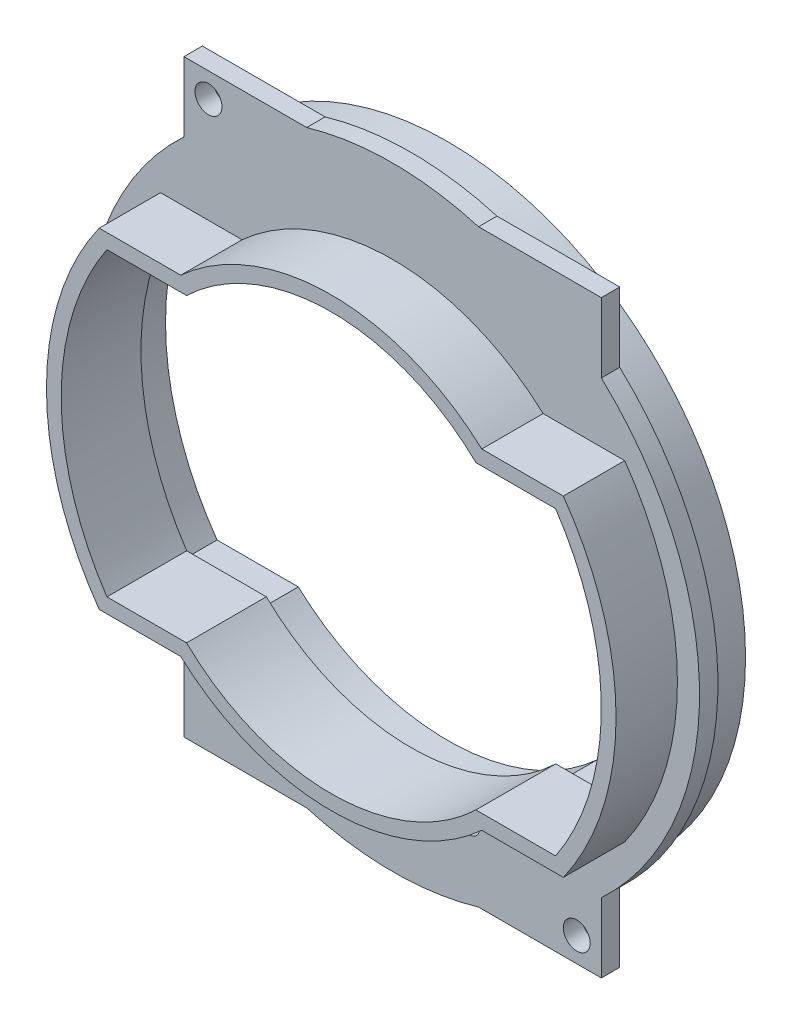
from build123d import *

# Parameters (mm, degrees)
SKETCH_1_R          = 25
EXTRUDE_1_DEPTH     = 1.5
EXTRUDE_2_DEPTH     = 5
SKETCH_5_R          = 24.25
EXTRUDE_4_DEPTH     = 3
EXTRUDE_5_DEPTH     = 1.5
SKETCH_7_R          = 0.5
CUT_EXTRUDE_2_DEPTH = 37.609425016
SKETCH_8_R          = 0.8
CUT_EXTRUDE_3_DEPTH = 4
SKETCH_9_R          = 1.1
CUT_EXTRUDE_4_DEPTH = 10


with BuildPart() as part:
    # 草图1 → 凸台-拉伸1 (new body)
    with BuildSketch(Plane.XY):
        Circle(SKETCH_1_R)
        with BuildLine():
            Line((-18.273956879, 12.25), (-11.787175234, 12.25))
            ThreePointArc((-11.787175234, 12.25), (0, 17), (11.787175234, 12.25))
            Line((11.787175234, 12.25), (18.273956879, 12.25))
            ThreePointArc((18.273956879, 12.25), (22, 0), (18.273956879, -12.25))
            Line((18.273956879, -12.25), (11.787175234, -12.25))
            ThreePointArc((11.787175234, -12.25), (0, -17), (-11.787175234, -12.25))
            Line((-11.787175234, -12.25), (-18.273956879, -12.25))
            ThreePointArc((-18.273956879, -12.25), (-22, 0), (-18.273956879, 12.25))
        make_face(mode=Mode.SUBTRACT)
    extrude(amount=EXTRUDE_1_DEPTH)

    # 草图2 → 凸台-拉伸2 (add)
    with BuildSketch(Plane.XY.offset(1.5)):
        with BuildLine():
            Line((-18.903372715, 13.45), (-12.261219352, 13.45))
            ThreePointArc((-12.261219352, 13.45), (0, 18.2), (12.261219352, 13.45))
            Line((12.261219352, 13.45), (18.903372715, 13.45))
            ThreePointArc((18.903372715, 13.45), (23.2, 0), (18.903372715, -13.45))
            Line((18.903372715, -13.45), (12.261219352, -13.45))
            ThreePointArc((12.261219352, -13.45), (0, -18.2), (-12.261219352, -13.45))
            Line((-12.261219352, -13.45), (-18.903372715, -13.45))
            ThreePointArc((-18.903372715, -13.45), (-23.2, 0), (-18.903372715, 13.45))
        make_face()
        with BuildLine():
            Line((-18.273956879, 12.25), (-11.787175234, 12.25))
            ThreePointArc((-11.787175234, 12.25), (0, 17), (11.787175234, 12.25))
            Line((11.787175234, 12.25), (18.273956879, 12.25))
            ThreePointArc((18.273956879, 12.25), (22, 0), (18.273956879, -12.25))
            Line((18.273956879, -12.25), (11.787175234, -12.25))
            ThreePointArc((11.787175234, -12.25), (0, -17), (-11.787175234, -12.25))
            Line((-11.787175234, -12.25), (-18.273956879, -12.25))
            ThreePointArc((-18.273956879, -12.25), (-22, 0), (-18.273956879, 12.25))
        make_face(mode=Mode.SUBTRACT)
    extrude(amount=EXTRUDE_2_DEPTH)

    # 草图5 → 凸台-拉伸4 (add)
    with BuildSketch(Plane(origin=(0, 0, 0), x_dir=(-1, 0, 0), z_dir=(0, 0, -1))):
        Circle(SKETCH_5_R)
        with BuildLine():
            Line((-18.799933511, -13.25), (-12.183492931, -13.25))
            ThreePointArc((-12.183492931, -13.25), (0, -18), (12.183492931, -13.25))
            Line((12.183492931, -13.25), (18.799933511, -13.25))
            ThreePointArc((18.799933511, -13.25), (23, 0), (18.799933511, 13.25))
            Line((18.799933511, 13.25), (12.183492931, 13.25))
            ThreePointArc((12.183492931, 13.25), (0, 18), (-12.183492931, 13.25))
            Line((-12.183492931, 13.25), (-18.799933511, 13.25))
            ThreePointArc((-18.799933511, 13.25), (-23, 0), (-18.799933511, -13.25))
        make_face(mode=Mode.SUBTRACT)
    extrude(amount=EXTRUDE_4_DEPTH)

    # 草图6 → 凸台-拉伸5 (add)
    with BuildSketch(Plane.XY):
        with BuildLine():
            Line((-17, -16.941074346), (-17, -24))
            Line((-17, -24), (0, -24))
            ThreePointArc((0, -24), (-9.203646443, -22.16512784), (-17, -16.941074346))
        make_face()
        with BuildLine():
            ThreePointArc((17, -16.941074346), (9.203646443, -22.16512784), (0, -24))
            Line((0, -24), (17, -24))
            Line((17, -24), (17, -16.941074346))
        make_face()
        with BuildLine():
            Line((-17, 24), (-17, 16.941074346))
            ThreePointArc((-17, 16.941074346), (-9.203646443, 22.16512784), (0, 24))
            Line((0, 24), (-17, 24))
        make_face()
        with BuildLine():
            ThreePointArc((0, 24), (9.203646443, 22.16512784), (17, 16.941074346))
            Line((17, 16.941074346), (17, 24))
            Line((17, 24), (0, 24))
        make_face()
    extrude(amount=EXTRUDE_5_DEPTH)

    # 草图7 → 切除-拉伸2 (cut, through all)
    with BuildSketch(Plane(origin=(0, 0, -3), x_dir=(-1, 0, 0), z_dir=(0, 0, -1))):
        with Locations((-12.857243394, -14.660876246)):
            Circle(SKETCH_7_R)
        with Locations((-10.833619544, -16.21365744)):
            Circle(SKETCH_7_R)
        with Locations((-8.624629459, -17.48901846)):
            Circle(SKETCH_7_R)
        with Locations((-6.268069573, -18.465137525)):
            Circle(SKETCH_7_R)
        with Locations((-3.804261279, -19.125312968)):
            Circle(SKETCH_7_R)
        with Locations((-1.27536102, -19.458249003)):
            Circle(SKETCH_7_R)
        with Locations((1.27536102, -19.458249003)):
            Circle(SKETCH_7_R)
        with Locations((3.804261279, -19.125312968)):
            Circle(SKETCH_7_R)
        with Locations((6.268069573, -18.465137525)):
            Circle(SKETCH_7_R)
        with Locations((8.624629459, -17.48901846)):
            Circle(SKETCH_7_R)
    extrude(amount=-CUT_EXTRUDE_2_DEPTH, mode=Mode.SUBTRACT)

    # 草图8 → 切除-拉伸3 (cut)
    with BuildSketch(Plane.XY.offset(1.5)):
        with Locations((12.857243394, -14.660876246)):
            Circle(SKETCH_8_R)
        with Locations((10.833619544, -16.21365744)):
            Circle(SKETCH_8_R)
        with Locations((8.624629459, -17.48901846)):
            Circle(SKETCH_8_R)
        with Locations((6.268069573, -18.465137525)):
            Circle(SKETCH_8_R)
        with Locations((3.804261279, -19.125312968)):
            Circle(SKETCH_8_R)
        with Locations((1.27536102, -19.458249003)):
            Circle(SKETCH_8_R)
        with Locations((-1.27536102, -19.458249003)):
            Circle(SKETCH_8_R)
        with Locations((-3.804261279, -19.125312968)):
            Circle(SKETCH_8_R)
        with Locations((-6.268069573, -18.465137525)):
            Circle(SKETCH_8_R)
        with Locations((-8.624629459, -17.48901846)):
            Circle(SKETCH_8_R)
    extrude(amount=-CUT_EXTRUDE_3_DEPTH, mode=Mode.SUBTRACT)

    # 草图9 → 切除-拉伸4 (cut)
    with BuildSketch(Plane.XY.offset(1.5)):
        with Locations((-15, 22)):
            Circle(SKETCH_9_R)
        with Locations((15, -22)):
            Circle(SKETCH_9_R)
    extrude(amount=-CUT_EXTRUDE_4_DEPTH, mode=Mode.SUBTRACT)


solid = part.part
